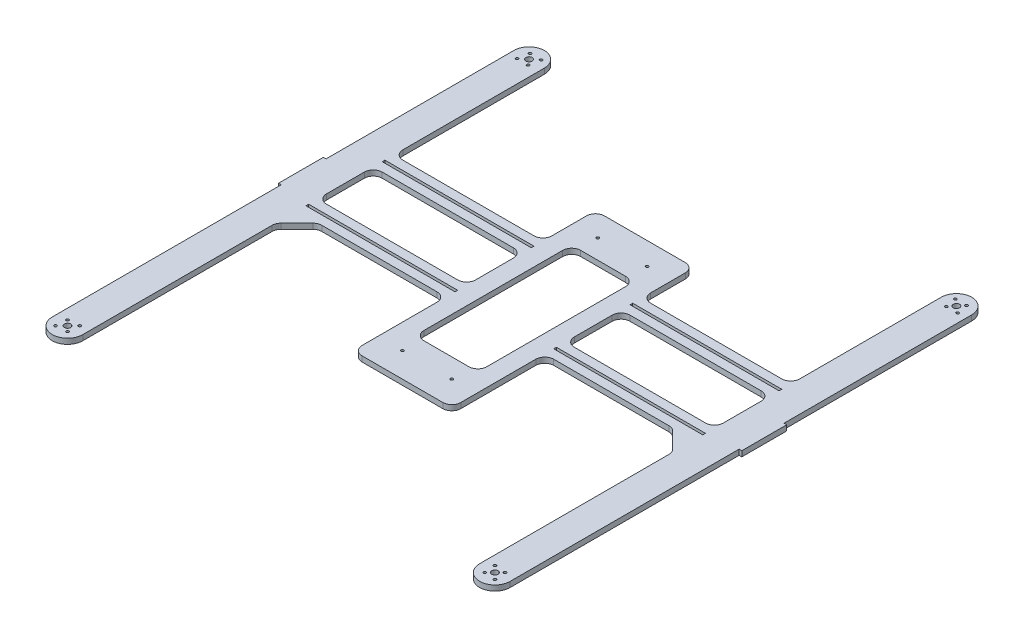
from build123d import *

# Parameters (mm, degrees)
SKETCH1_R           = 1.5
SKETCH1_R_2         = 3.5
SKETCH1_W           = 166
SKETCH1_H           = 3
SKETCH1_H_2         = 62
SKETCH1_W_2         = 70
SKETCH1_H_3         = 174.5
BOSS_EXTRUDE1_DEPTH = 6
FILLET_1_R          = 10


with BuildPart() as part:
    # Sketch1 → Boss-Extrude1 (new body)
    with BuildSketch(Plane(origin=(0, 0, 0), x_dir=(1, 0, 0), z_dir=(0, 1, 0))):
        with BuildLine():
            Line((192.5, -16.5), (216, -40))
            Line((216, -40), (216, -255))
            ThreePointArc((216, -255), (233, -272), (250, -255))
            Line((250, -255), (250, 0))
            Line((250, 0), (253, 0))
            Line((253, 0), (253, 50))
            Line((253, 50), (250, 50))
            Line((250, 50), (250, 259.060301809))
            ThreePointArc((250, 259.060301809), (233, 276.060301809), (216, 259.060301809))
            Line((216, 259.060301809), (216, 91.5))
            Line((216, 91.5), (50, 91.5))
            Line((50, 91.5), (50, 150))
            Line((50, 150), (-60, 150))
            Line((-60, 150), (-60, 91.5))
            Line((-60, 91.5), (-226, 91.5))
            Line((-226, 91.5), (-226, 259.060301809))
            ThreePointArc((-226, 259.060301809), (-243, 276.060301809), (-260, 259.060301809))
            Line((-260, 259.060301809), (-260, 50))
            Line((-260, 50), (-263, 50))
            Line((-263, 50), (-263, 0))
            Line((-263, 0), (-260, 0))
            Line((-260, 0), (-260, -255))
            ThreePointArc((-260, -255), (-243, -272), (-226, -255))
            Line((-226, -255), (-226, -40))
            Line((-226, -40), (-202.5, -16.5))
            Line((-202.5, -16.5), (-60, -16.5))
            Line((-60, -16.5), (-60, -120))
            Line((-60, -120), (50, -120))
            Line((50, -120), (50, -16.5))
            Line((50, -16.5), (192.5, -16.5))
        make_face()
        with Locations((-249.717514421, -261.717514421)):
            Circle(SKETCH1_R, mode=Mode.SUBTRACT)
        with Locations((-243, -255)):
            Circle(SKETCH1_R_2, mode=Mode.SUBTRACT)
        with Locations((-237.343145751, -260.656854249)):
            Circle(SKETCH1_R, mode=Mode.SUBTRACT)
        with Locations((-248.656854249, -249.343145751)):
            Circle(SKETCH1_R, mode=Mode.SUBTRACT)
        with Locations((-236.282485579, -248.282485579)):
            Circle(SKETCH1_R, mode=Mode.SUBTRACT)
        with Locations((-143, -5)):
            Rectangle(SKETCH1_W, SKETCH1_H, mode=Mode.SUBTRACT)
        with Locations((-32.5, -92.5)):
            Circle(SKETCH1_R, mode=Mode.SUBTRACT)
        with Locations((227.343145751, -260.656854249)):
            Circle(SKETCH1_R, mode=Mode.SUBTRACT)
        with Locations((233, -255)):
            Circle(SKETCH1_R_2, mode=Mode.SUBTRACT)
        with Locations((239.717514421, -261.717514421)):
            Circle(SKETCH1_R, mode=Mode.SUBTRACT)
        with Locations((226.282485579, -248.282485579)):
            Circle(SKETCH1_R, mode=Mode.SUBTRACT)
        with Locations((238.656854249, -249.343145751)):
            Circle(SKETCH1_R, mode=Mode.SUBTRACT)
        with Locations((22.5, -92.5)):
            Circle(SKETCH1_R, mode=Mode.SUBTRACT)
        with Locations((133, -5)):
            Rectangle(SKETCH1_W, SKETCH1_H, mode=Mode.SUBTRACT)
        with Locations((-143, 37.5)):
            Rectangle(SKETCH1_W, SKETCH1_H_2, mode=Mode.SUBTRACT)
        with Locations((-143, 80)):
            Rectangle(SKETCH1_W, SKETCH1_H, mode=Mode.SUBTRACT)
        with Locations((-32.5, 125)):
            Circle(SKETCH1_R, mode=Mode.SUBTRACT)
        with Locations((-250.326962678, 253.013350683)):
            Circle(SKETCH1_R, mode=Mode.SUBTRACT)
        with Locations((-237.907830631, 252.890227975)):
            Circle(SKETCH1_R, mode=Mode.SUBTRACT)
        with Locations((-248.092169369, 265.230375643)):
            Circle(SKETCH1_R, mode=Mode.SUBTRACT)
        with Locations((-243, 259.060301809)):
            Circle(SKETCH1_R_2, mode=Mode.SUBTRACT)
        with Locations((-235.673037322, 265.107252935)):
            Circle(SKETCH1_R, mode=Mode.SUBTRACT)
        with Locations((-5, 16.25)):
            Rectangle(SKETCH1_W_2, SKETCH1_H_3, mode=Mode.SUBTRACT)
        with Locations((22.5, 125)):
            Circle(SKETCH1_R, mode=Mode.SUBTRACT)
        with Locations((133, 37.5)):
            Rectangle(SKETCH1_W, SKETCH1_H_2, mode=Mode.SUBTRACT)
        with Locations((133, 80)):
            Rectangle(SKETCH1_W, SKETCH1_H, mode=Mode.SUBTRACT)
        with Locations((227.907830631, 252.890227975)):
            Circle(SKETCH1_R, mode=Mode.SUBTRACT)
        with Locations((240.326962678, 253.013350683)):
            Circle(SKETCH1_R, mode=Mode.SUBTRACT)
        with Locations((225.673037322, 265.107252935)):
            Circle(SKETCH1_R, mode=Mode.SUBTRACT)
        with Locations((233, 259.060301809)):
            Circle(SKETCH1_R_2, mode=Mode.SUBTRACT)
        with Locations((238.092169369, 265.230375643)):
            Circle(SKETCH1_R, mode=Mode.SUBTRACT)
    extrude(amount=BOSS_EXTRUDE1_DEPTH)

    # Скругление1
    fillet_1_edges = [part.edges().sort_by_distance(p)[0] for p in [
        (216, 3, -6.5),
        (216, 3, -68.5),
        (216, 3, -91.5),
        (-226, 3, -6.5),
        (-226, 3, -68.5),
        (-226, 3, -91.5),
        (-226, 3, 40),
        (-202.5, 3, 16.5),
        (216, 3, 40),
        (192.5, 3, 16.5),
        (-40, 3, 71),
        (30, 3, 71),
        (30, 3, -103.5),
        (-40, 3, -103.5),
        (-60, 3, -150),
        (50, 3, -150),
        (-60, 3, 120),
        (50, 3, 120),
        (50, 3, -68.5),
        (50, 3, -91.5),
        (50, 3, -6.5),
        (50, 3, 16.5),
        (-60, 3, -91.5),
        (-60, 3, 16.5),
        (-60, 3, -6.5),
        (-60, 3, -68.5),
    ]]
    fillet(fillet_1_edges, radius=FILLET_1_R)


solid = part.part
